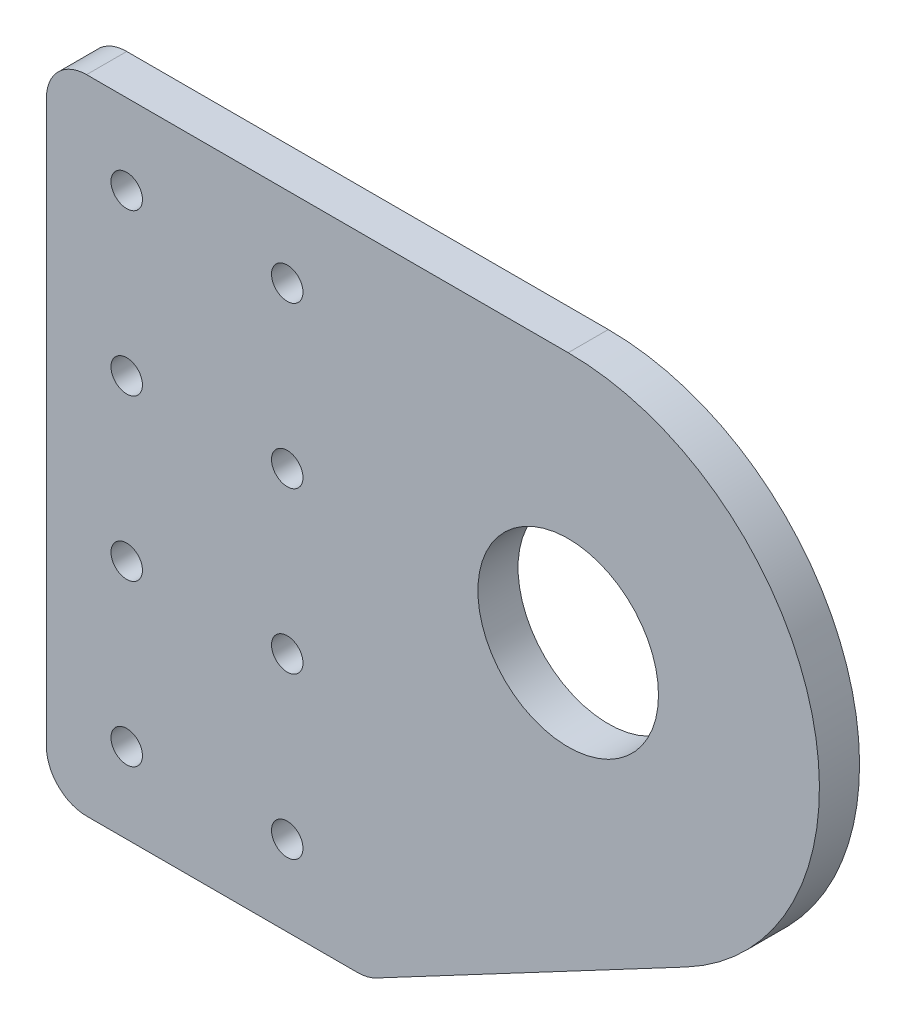
from build123d import *

# Parameters (mm, degrees)
BOSS_EXTRUDE1_DEPTH                          = 6.35
PLEXI_PLATE_HOLES_599_24_SEASON_BR_S_000_R   = 14.2875
PLEXI_PLATE_HOLES_599_24_SEASON_BR_S_000_R_2 = 2.4892
CUT_EXTRUDE2_DEPTH                           = 768.011008984
FILLET1_R                                    = 6.35


with BuildPart() as part:
    # Sketch5-599-24-season-BR-S-0001<3> → Boss-Extrude1 (new body)
    with BuildSketch(Plane.XY):
        with BuildLine():
            Line((482.6, 471.551), (565.15, 471.551))
            ThreePointArc((565.15, 471.551), (603.724208124, 441.400649385), (583.78286194, 396.686491817))
            Line((583.78286194, 396.686491817), (533.4, 369.951))
            Line((533.4, 369.951), (482.6, 369.951))
            Line((482.6, 369.951), (482.6, 471.551))
        make_face()
    extrude(amount=BOSS_EXTRUDE1_DEPTH)

    # Plexi plate holes-599-24-season-BR-S-000 → Cut-Extrude2 (cut, through all)
    with BuildSketch(Plane.XY):
        with Locations((565.15, 431.8)):
            Circle(PLEXI_PLATE_HOLES_599_24_SEASON_BR_S_000_R)
        with Locations((495.3, 458.851)):
            Circle(PLEXI_PLATE_HOLES_599_24_SEASON_BR_S_000_R_2)
        with Locations((520.7, 458.851)):
            Circle(PLEXI_PLATE_HOLES_599_24_SEASON_BR_S_000_R_2)
        with Locations((520.7, 433.451)):
            Circle(PLEXI_PLATE_HOLES_599_24_SEASON_BR_S_000_R_2)
        with Locations((520.7, 408.051)):
            Circle(PLEXI_PLATE_HOLES_599_24_SEASON_BR_S_000_R_2)
        with Locations((520.7, 382.651)):
            Circle(PLEXI_PLATE_HOLES_599_24_SEASON_BR_S_000_R_2)
        with Locations((495.3, 433.451)):
            Circle(PLEXI_PLATE_HOLES_599_24_SEASON_BR_S_000_R_2)
        with Locations((495.3, 408.051)):
            Circle(PLEXI_PLATE_HOLES_599_24_SEASON_BR_S_000_R_2)
        with Locations((495.3, 382.651)):
            Circle(PLEXI_PLATE_HOLES_599_24_SEASON_BR_S_000_R_2)
    extrude(amount=CUT_EXTRUDE2_DEPTH, mode=Mode.SUBTRACT)

    # Fillet1
    fillet1_edges = [part.edges().sort_by_distance(p)[0] for p in [
        (533.4, 369.951, 3.175),
        (482.6, 369.951, 3.175),
        (482.6, 471.551, 3.175),
    ]]
    fillet(fillet1_edges, radius=FILLET1_R)


solid = part.part
